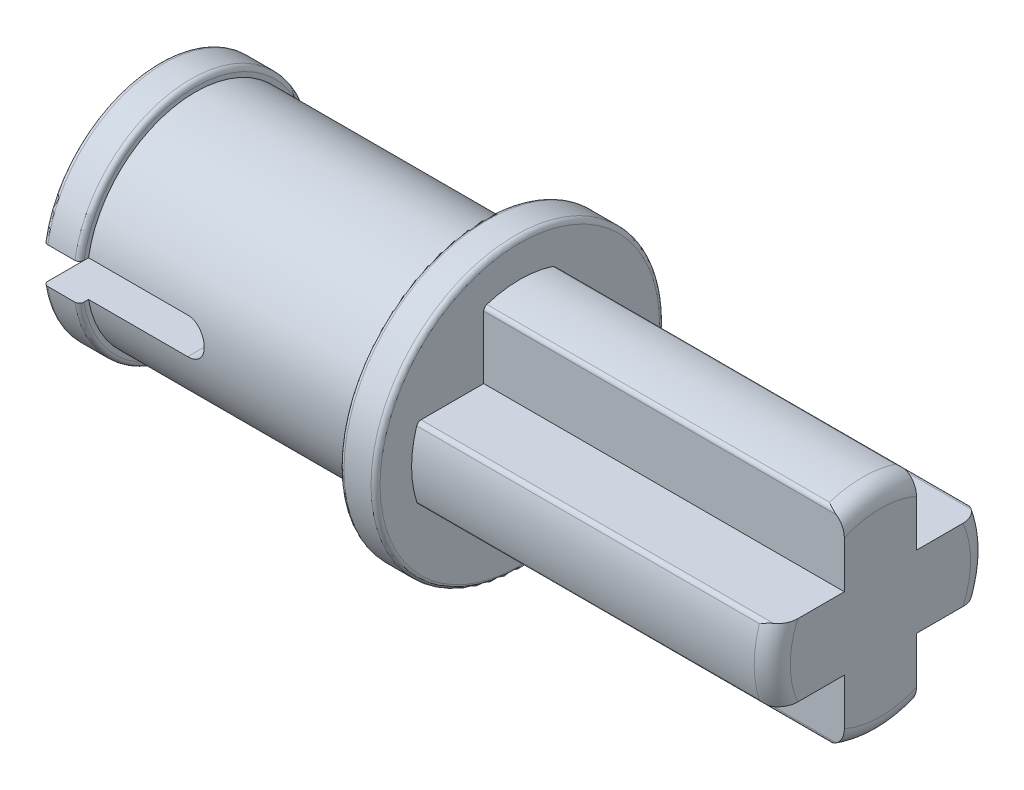
from build123d import *
from build123d.topology import SkipClean

# Parameters (mm, degrees)
SKETCH1_W                  = 4.2
SKETCH1_H                  = 2.4
F_0_8_0_8_DIAMETER_HOLE1_D = 0.8
SKETCH6_R                  = 3.2
BOSS_EXTRUDE1_DEPTH        = 0.8
BOSS_EXTRUDE2_DEPTH        = 3
CUT_EXTRUDE1_DEPTH         = 2.2
BOSS_EXTRUDE3_DEPTH        = 2.2
BOSS_EXTRUDE4_DEPTH        = 0.8
BOSS_EXTRUDE5_START        = 8
BOSS_EXTRUDE5_DEPTH        = 8
SKETCH16_W                 = 7.2
SKETCH16_H                 = 1.6
FILLET1_R                  = 0.1
FILLET2_R                  = 0.4


with BuildPart() as part:
    # Sketch1 → Revolve1 (revolve)
    with BuildSketch(Plane.XY):
        with Locations((-2.9, 1.2)):
            Rectangle(SKETCH1_W, SKETCH1_H)
    revolve(axis=Axis((-5, 0, 0), (1, 0, 0)))

    # Ø0.8 (0.8) Diameter Hole1 (through all)
    with Locations(Plane(origin=(-5, 0, -2.4), x_dir=(0, -1, 0), z_dir=(0, 0, -1))):
        with Locations((0, 0)):
            Hole(F_0_8_0_8_DIAMETER_HOLE1_D / 2)

    # Sketch6 → Boss-Extrude1 (add)
    with BuildSketch(Plane.ZY.offset(0.8)):
        Circle(SKETCH6_R)
    extrude(amount=-BOSS_EXTRUDE1_DEPTH)

    # Sketch7 → Boss-Extrude2 (add)
    with BuildSketch(Plane.ZY.offset(5)):
        with BuildLine():
            Line((-2.569046516, -0.4), (2.569046516, -0.4))
            ThreePointArc((2.569046516, -0.4), (0, -2.6), (-2.569046516, -0.4))
        make_face()
    extrude(amount=BOSS_EXTRUDE2_DEPTH)

    # Sketch8 → Cut-Extrude1 (cut)
    with SkipClean():  # the faces are left unmerged after this step: merging them gives an invalid solid
        with BuildSketch(Plane(origin=(-5, 0, 0), x_dir=(0, 0, -1), z_dir=(1, 0, 0))):
            with BuildLine():
                Line((2.569046516, -0.4), (2.366431913, -0.4))
                ThreePointArc((2.366431913, -0.4), (0, -2.4), (-2.366431913, -0.4))
                Line((-2.366431913, -0.4), (-2.569046516, -0.4))
                ThreePointArc((-2.569046516, -0.4), (0, -2.6), (2.569046516, -0.4))
            make_face()
        extrude(amount=-CUT_EXTRUDE1_DEPTH, mode=Mode.SUBTRACT)

    # Sketch9 → Boss-Extrude3 (add)
    with SkipClean():  # the faces are left unmerged after this step: merging them gives an invalid solid
        with BuildSketch(Plane.ZY.offset(5)):
            with BuildLine():
                Line((2.366431913, 0.4), (-2.366431913, 0.4))
                ThreePointArc((-2.366431913, 0.4), (0, 2.4), (2.366431913, 0.4))
            make_face()
        extrude(amount=BOSS_EXTRUDE3_DEPTH)

    # Sketch10 → Boss-Extrude4 (add)
    with SkipClean():  # the faces are left unmerged after this step: merging them gives an invalid solid
        with BuildSketch(Plane.ZY.offset(7.2)):
            with BuildLine():
                Line((2.569046516, 0.4), (-2.569046516, 0.4))
                ThreePointArc((-2.569046516, 0.4), (0, 2.6), (2.569046516, 0.4))
            make_face()
        extrude(amount=BOSS_EXTRUDE4_DEPTH)

    # Sketch11 → Boss-Extrude5 (add)
    with SkipClean():  # the faces are left unmerged after this step: merging them gives an invalid solid
        with BuildSketch(Plane(origin=(0, 0, 0), x_dir=(0, 0, -1), z_dir=(1, 0, 0)).offset(BOSS_EXTRUDE5_START)):
            with BuildLine():
                Line((2.2627417, -0.8), (0.8, -0.8))
                Line((0.8, -0.8), (0.8, -2.2627417))
                ThreePointArc((0.8, -2.2627417), (0, -2.4), (-0.8, -2.2627417))
                Line((-0.8, -2.2627417), (-0.8, -0.8))
                Line((-0.8, -0.8), (-2.2627417, -0.8))
                ThreePointArc((-2.2627417, -0.8), (-2.4, 0), (-2.2627417, 0.8))
                Line((-2.2627417, 0.8), (-0.8, 0.8))
                Line((-0.8, 0.8), (-0.8, 2.2627417))
                ThreePointArc((-0.8, 2.2627417), (0, 2.4), (0.8, 2.2627417))
                Line((0.8, 2.2627417), (0.8, 0.8))
                Line((0.8, 0.8), (2.2627417, 0.8))
                ThreePointArc((2.2627417, 0.8), (2.4, 0), (2.2627417, -0.8))
            make_face()
        extrude(amount=-BOSS_EXTRUDE5_DEPTH)

    # Sketch16 → Cut-Revolve1 (revolve, cut)
    with SkipClean():  # the faces are left unmerged after this step: merging them gives an invalid solid
        with BuildSketch(Plane(origin=(0, 0, 0), x_dir=(-1, 0, 0), z_dir=(0, 0, -1))):
            with Locations((4.4, 0.8)):
                Rectangle(SKETCH16_W, SKETCH16_H)
        revolve(axis=Axis((-0.8, 0, 0), (-1, 0, 0)), mode=Mode.SUBTRACT)

    # Fillet1
    fillet1_edges = [part.edges().sort_by_distance(p)[0] for p in [
        (0, 0, -3.2),
        (-0.8, 0, -3.2),
        (-8, -2.6, 0),
        (-7.2, -2.6, 0),
        (-7.2, 2.6, 0),
        (-8, 2.6, 0),
        (4, -0.8, -2.2627417),
        (4, 0.8, -2.2627417),
        (4, 2.2627417, -0.8),
        (4, 2.2627417, 0.8),
        (4, 0.8, 2.2627417),
        (4, -0.8, 2.2627417),
        (4, -2.2627417, 0.8),
        (4, -2.2627417, -0.8),
    ]]
    fillet(fillet1_edges, radius=FILLET1_R)

    # Fillet2
    # the kernel refuses this fillet: 0.4 mm, written as the material it takes off along each edge
    with BuildSketch(Plane(origin=(8, 0, 0), x_dir=(0, -0.6638434598853418, 0.7478715536557455), z_dir=(0, -0.7478715536557455, -0.6638434598853418))) as fillet2_piece_1:
        with BuildLine():
            CenterArc((2.4 - FILLET2_R, FILLET2_R), FILLET2_R, 270, 90)
            Line((2.4 - FILLET2_R, 0), (2.4, 0))
            Line((2.4, 0), (2.4, FILLET2_R))
        make_face()
    revolve(axis=Axis((8, 0, 0), (-1, 0, 0)), revolution_arc=83.187319702, mode=Mode.SUBTRACT)
    with BuildSketch(Plane(origin=(8, 0, 0), x_dir=(0, -0.7478715536557221, -0.6638434598853682), z_dir=(0, 0.6638434598853682, -0.7478715536557221))) as fillet2_piece_2:
        with BuildLine():
            CenterArc((2.4 - FILLET2_R, FILLET2_R), FILLET2_R, 270, 90)
            Line((2.4 - FILLET2_R, 0), (2.4, 0))
            Line((2.4, 0), (2.4, FILLET2_R))
        make_face()
    revolve(axis=Axis((8, 0, 0), (-1, 0, 0)), revolution_arc=83.187319702, mode=Mode.SUBTRACT)
    with BuildSketch(Plane(origin=(8, 0, 0), x_dir=(0, 0.7478715536557219, 0.6638434598853683), z_dir=(0, -0.6638434598853683, 0.7478715536557219))) as fillet2_piece_3:
        with BuildLine():
            CenterArc((2.4 - FILLET2_R, FILLET2_R), FILLET2_R, 270, 90)
            Line((2.4 - FILLET2_R, 0), (2.4, 0))
            Line((2.4, 0), (2.4, FILLET2_R))
        make_face()
    revolve(axis=Axis((8, 0, 0), (-1, 0, 0)), revolution_arc=83.187319702, mode=Mode.SUBTRACT)
    with BuildSketch(Plane(origin=(8, 0, 0), x_dir=(0, 0.6638434598852943, -0.7478715536557876), z_dir=(0, 0.7478715536557876, 0.6638434598852943))) as fillet2_piece_4:
        with BuildLine():
            CenterArc((2.4 - FILLET2_R, FILLET2_R), FILLET2_R, 270, 90)
            Line((2.4 - FILLET2_R, 0), (2.4, 0))
            Line((2.4, 0), (2.4, FILLET2_R))
        make_face()
    revolve(axis=Axis((8, 0, 0), (-1, 0, 0)), revolution_arc=83.187319702, mode=Mode.SUBTRACT)


solid = part.part
